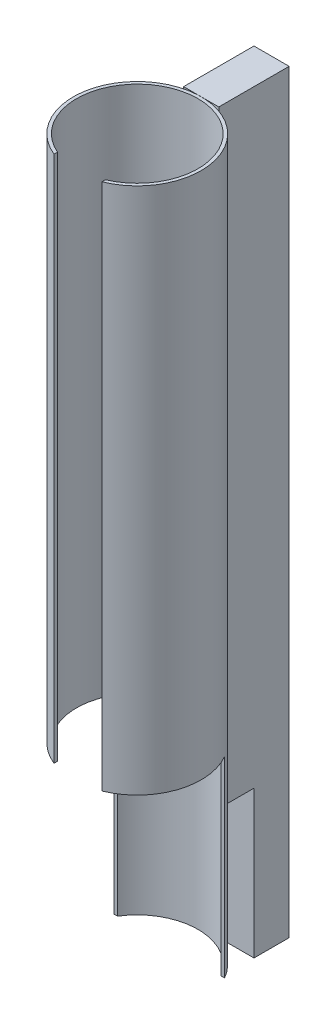
from build123d import *

# Parameters (mm, degrees)
ESQUISSE1_R                  = 40
ESQUISSE1_R_2                = 38
BOSS_EXTRU_1_DEPTH           = 450
ENL_V_MAT_EXTRU_1_DEPTH      = 454.541618818
ENL_V_MAT_EXTRU_1_DEPTH_BACK = 20
ESQUISSE2_W                  = 80
ESQUISSE2_H                  = 120
BOSS_EXTRU_2_DEPTH           = 11
ESQUISSE4_W                  = 30
ESQUISSE4_H                  = 450
ENL_V_MAT_EXTRU_2_DEPTH      = 460.517137874


with BuildPart() as part:
    # Esquisse1 → Boss.-Extru.1 (new body)
    with BuildSketch(Plane(origin=(0, 0, 0), x_dir=(1, 0, 0), z_dir=(0, 1, 0))):
        Circle(ESQUISSE1_R)
        Circle(ESQUISSE1_R_2, mode=Mode.SUBTRACT)
    extrude(amount=BOSS_EXTRU_1_DEPTH)

    # Esquisse2 → Enlèv. mat.-Extru.1 (cut, two sides: drawn at the far end of the back side and taken through both)
    with BuildSketch(Plane.XY.offset(-ENL_V_MAT_EXTRU_1_DEPTH_BACK)):
        with Locations((0, 60)):
            Rectangle(ESQUISSE2_W, ESQUISSE2_H)
    extrude(amount=ENL_V_MAT_EXTRU_1_DEPTH + ENL_V_MAT_EXTRU_1_DEPTH_BACK, mode=Mode.SUBTRACT)

    # Esquisse4 → Enlèv. mat.-Extru.2 (cut, through all)
    with BuildSketch(Plane.XY):
        with Locations((0, 225)):
            Rectangle(ESQUISSE4_W, ESQUISSE4_H)
    extrude(amount=ENL_V_MAT_EXTRU_2_DEPTH, mode=Mode.SUBTRACT)


with BuildPart() as body_2:
    # Esquisse3 → Boss.-Extru.2 (new, symmetric)
    with BuildSketch(Plane(origin=(0, 0, 0), x_dir=(0, 0, -1), z_dir=(1, 0, 0))):
        Polygon((62, -22), (84, -22), (84, 450), (40, 450), (40, 70), (62, 70), align=None)
    extrude(amount=BOSS_EXTRU_2_DEPTH, both=True)


solid = Compound([part.part, body_2.part])
